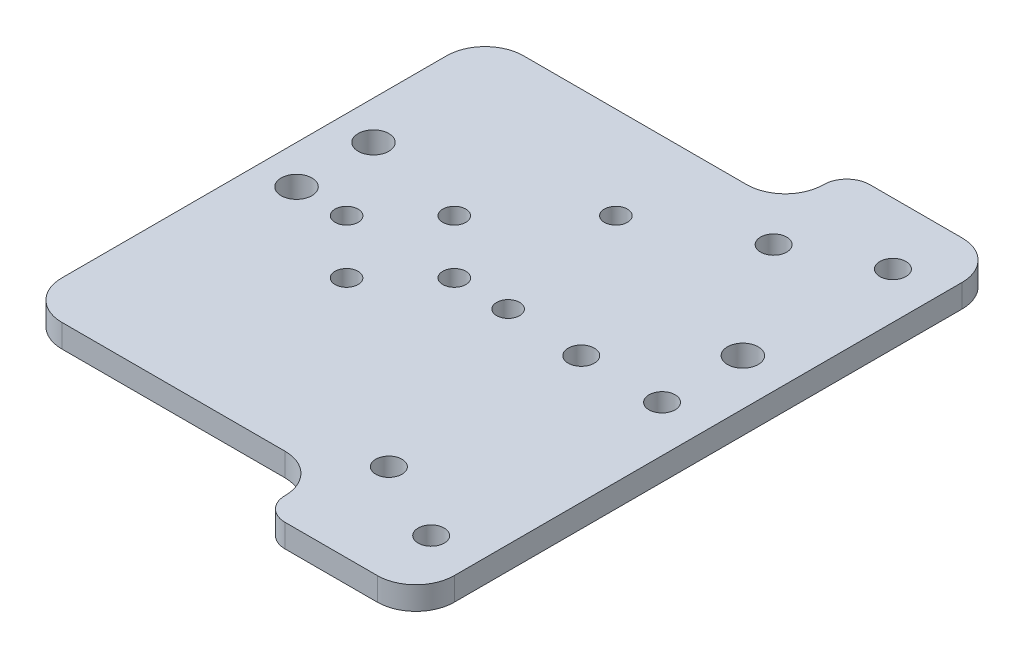
from build123d import *

# Parameters (mm, degrees)
SKETCH_1_R          = 1.7
EXTRUDE_1_DEPTH     = 3
SKETCH_2_R          = 1.5
SKETCH_2_R_2        = 2
CUT_EXTRUDE_1_DEPTH = 71.242437315
FILLET_1_R          = 5
FILLET_2_R          = 3


with BuildPart() as part:
    # 草图1 → 凸台-拉伸1 (new body)
    with BuildSketch(Plane(origin=(0, 0, 0), x_dir=(1, 0, 0), z_dir=(0, 1, 0))):
        Polygon((0, 0), (0, 30), (39, 30), (39, 38), (59, 38), (59, -38), (39, -38), (39, -30), (0, -30), align=None)
        with Locations(Location((42.5, 25, 0), (0, 0, 270))):
            Circle(SKETCH_1_R, mode=Mode.SUBTRACT)
        with Locations(Location((42.5, -25, 0), (0, 0, 270))):
            Circle(SKETCH_1_R, mode=Mode.SUBTRACT)
        with Locations(Location((42.5, 0, 0), (0, 0, 270))):
            Circle(SKETCH_1_R, mode=Mode.SUBTRACT)
        with Locations(Location((53, 30, 0), (0, 0, 270))):
            Circle(SKETCH_1_R, mode=Mode.SUBTRACT)
        with Locations(Location((53, 0, 0), (0, 0, 270))):
            Circle(SKETCH_1_R, mode=Mode.SUBTRACT)
        with Locations(Location((53, -30, 0), (0, 0, 270))):
            Circle(SKETCH_1_R, mode=Mode.SUBTRACT)
    extrude(amount=EXTRUDE_1_DEPTH)

    # 草图2 → 切除-拉伸1 (cut, through all)
    with BuildSketch(Plane(origin=(0, 3, 0), x_dir=(1, 0, 0), z_dir=(0, 1, 0))):
        with Locations(Location((32.5, 0.5, 0), (0, 0, 270))):
            Circle(SKETCH_2_R)
        with Locations(Location((5, 0.5, 0), (0, 0, 270))):
            Circle(SKETCH_2_R_2)
        with Locations(Location((5, 10.5, 0), (0, 0, 270))):
            Circle(SKETCH_2_R_2)
        with Locations(Location((53, 10.5, 0), (0, 0, 270))):
            Circle(SKETCH_2_R_2)
        with Locations(Location((29, 18, 0), (0, 0, 270))):
            Circle(SKETCH_2_R)
        with Locations(Location((18.5, -6.5, 0), (0, 0, 270))):
            Circle(SKETCH_2_R)
        with Locations(Location((11.5, 0.5, 0), (0, 0, 270))):
            Circle(SKETCH_2_R)
        with Locations(Location((25.5, 0.5, 0), (0, 0, 270))):
            Circle(SKETCH_2_R)
        with Locations(Location((18.5, 7.5, 0), (0, 0, 270))):
            Circle(SKETCH_2_R)
    extrude(amount=-CUT_EXTRUDE_1_DEPTH, mode=Mode.SUBTRACT)

    # 圆角1
    fillet_1_edges = [part.edges().sort_by_distance(p)[0] for p in [
        (59, 1.5, 38),
        (39, 1.5, 30),
        (0, 1.5, 30),
        (0, 1.5, -30),
        (39, 1.5, -30),
        (59, 1.5, -38),
    ]]
    fillet(fillet_1_edges, radius=FILLET_1_R)

    # 圆角2
    fillet_2_edges = [part.edges().sort_by_distance(p)[0] for p in [
        (39, 1.5, 38),
        (39, 1.5, -38),
    ]]
    fillet(fillet_2_edges, radius=FILLET_2_R - 0.0001)  # a hair under: the kernel refuses the full size


solid = part.part
